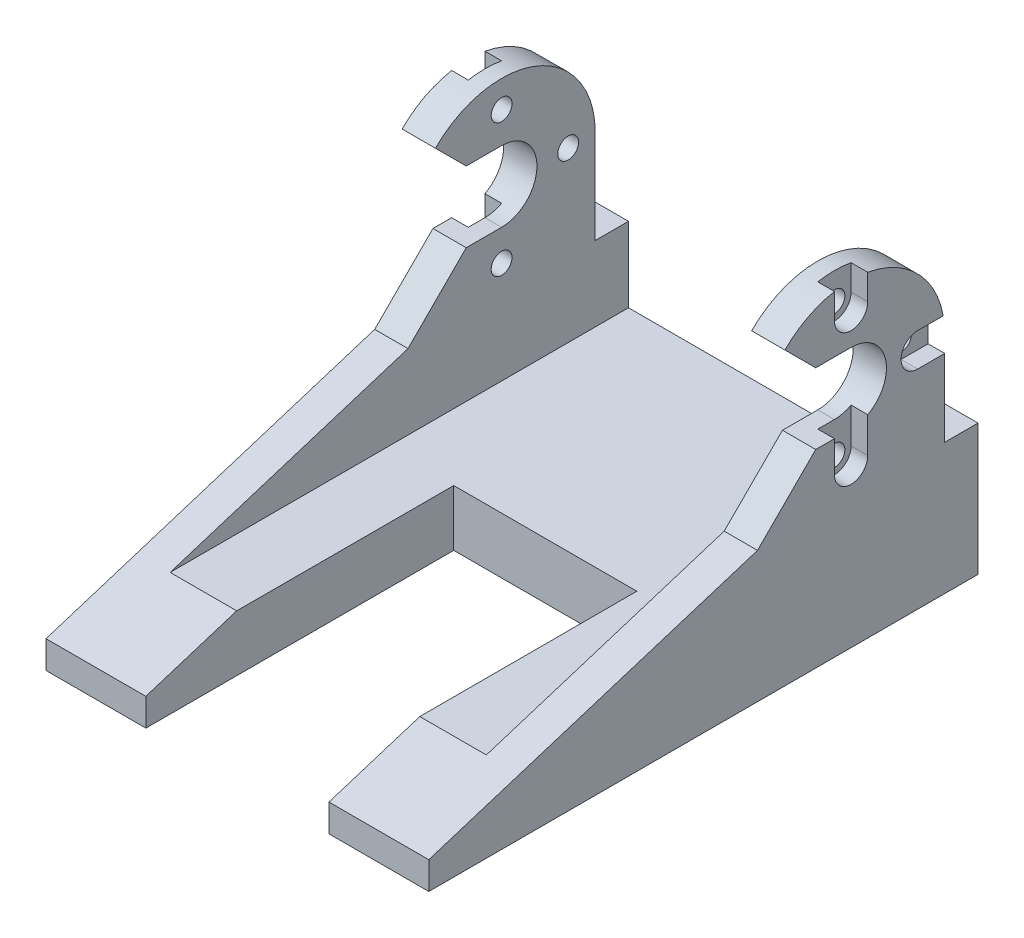
from build123d import *

# Parameters (mm, degrees)
SKETCH1_W                = 50
SKETCH1_H                = 170
BOSS_EXTRUDE1_DEPTH      = 55
SKETCH2_W                = 34
SKETCH2_H                = 27
CUT_EXTRUDE1_DEPTH       = 181.416185527
SKETCH3_W                = 10
SKETCH3_H                = 24
SKETCH3_R                = 4.25
SKETCH3_R_2              = 1
CUT_EXTRUDE2_DEPTH       = 186.539753153
SKETCH4_W                = 2
SKETCH4_H                = 24
CUT_EXTRUDE3_DEPTH       = 178.623196683
SKETCH5_W                = 6.25
SKETCH5_H                = 11.25
CUT_EXTRUDE4_DEPTH       = 186.539753153
SKETCH6_W                = 38
SKETCH6_H                = 10
CUT_EXTRUDE5_DEPTH       = 181.416185527
SKETCH8_W                = 13.25
SKETCH8_H                = 2.25
CUT_EXTRUDE7_DEPTH       = 186.539753153
SKETCH9_W                = 34
SKETCH9_H                = 35.25
CUT_EXTRUDE8_DEPTH       = 179.297679458
SKETCH11_W               = 13.25
SKETCH11_H               = 20.25
CUT_EXTRUDE9_DEPTH       = 184.480414486
SKETCH12_W               = 28.5
SKETCH12_H               = 15
BOSS_EXTRUDE2_DEPTH      = 8
SKETCH14_W               = 34
SKETCH14_H               = 15
SKETCH14_H_2             = 10.25
BOSS_EXTRUDE3_DEPTH      = 13.25
SKETCH16_R               = 4.5
SKETCH16_R_2             = 2.5
CUT_EXTRUDE13_DEPTH      = 8
SKETCH17_R               = 4.5
SKETCH17_W               = 55
SKETCH17_H               = 10.25
CUT_EXTRUDE15_DEPTH      = 175.384811552
SKETCH18_W               = 71.25
SKETCH18_H               = 27.5
SKETCH18_W_2             = 13.75
SKETCH18_W_3             = 16.25
BOSS_EXTRUDE4_DEPTH      = 50
SKETCH19_W               = 38
SKETCH19_H               = 7
CUT_EXTRUDE16_DEPTH      = 152.25227271
SKETCH20_W               = 57.5
SKETCH20_H               = 27.5
CUT_EXTRUDE17_DEPTH      = 102.137591923
CUT_EXTRUDE18_DEPTH      = 100.39221549
SKETCH22_W               = 82.5
SKETCH22_H               = 2.5
BOSS_EXTRUDE5_DEPTH      = 50
SKETCH24_W               = 22
SKETCH24_H               = 17
CUT_EXTRUDE19_DEPTH      = 101.710289941
SKETCH25_W               = 38
SKETCH25_H               = 38.136363636
CUT_EXTRUDE20_DEPTH      = 10
SKETCH27_W               = 38
SKETCH27_H               = 60.136363636
BOSS_EXTRUDE6_DEPTH      = 8.6
SKETCH29_W               = 38
SKETCH29_H               = 1.4
CUT_EXTRUDE21_DEPTH      = 85.601313414
BOSS_EXTRUDE7_DEPTH      = 50
SKETCH31_W               = 38
SKETCH31_H               = 17
CUT_EXTRUDE22_DEPTH      = 117.365802537
SKETCH32_W               = 100
SKETCH32_H               = 3
CUT_EXTRUDE23_DEPTH      = 101.710289941
SKETCH33_W               = 20
SKETCH33_H               = 10
SKETCH33_W_2             = 22
SKETCH33_H_2             = 45
CUT_EXTRUDE24_DEPTH      = 84.137311118
SKETCH34_W               = 8
SKETCH34_H               = 12
CUT_EXTRUDE25_DEPTH      = 76.0787087
BOSS_EXTRUDE8_DEPTH      = 8
SKETCH37_W               = 78
SKETCH37_H               = 9
SKETCH37_W_2             = 12
CUT_EXTRUDE27_DEPTH      = 93.48006542
FILLET1_R                = 10
CUT_EXTRUDE29_DEPTH      = 77.423572934
CUT_EXTRUDE29_DEPTH_BACK = 77.423572934
SKETCH38_W               = 2
SKETCH38_H               = 78
SKETCH38_W_2             = 46
SKETCH38_H_2             = 8
SKETCH39_W               = 22.223383748
SKETCH39_H               = 19.441332461
CUT_EXTRUDE30_DEPTH      = 86.624543794
BOSS_EXTRUDE9_DEPTH      = 0.75
CUT_EXTRUDE31_DEPTH      = 76.967920861
SKETCH44_R               = 1.25
CUT_EXTRUDE32_DEPTH      = 76.967920861
SKETCH45_R               = 1.25
CUT_EXTRUDE33_DEPTH      = 2
CUT_EXTRUDE34_DEPTH      = 76.967920861
SKETCH48_W               = 66
SKETCH48_H               = 3
CUT_EXTRUDE35_DEPTH      = 76.967920861


with BuildPart() as part:
    # Sketch1 → Boss-Extrude1 (new body)
    with BuildSketch(Plane.XY):
        with Locations((0, -85)):
            Rectangle(SKETCH1_W, SKETCH1_H)
    extrude(amount=-BOSS_EXTRUDE1_DEPTH)

    # Sketch2 → Cut-Extrude1 (cut, through all)
    with BuildSketch(Plane.XY):
        with Locations((0, -13.5)):
            Rectangle(SKETCH2_W, SKETCH2_H)
    extrude(amount=-CUT_EXTRUDE1_DEPTH, mode=Mode.SUBTRACT)

    # Sketch3 → Cut-Extrude2 (cut, through all)
    with BuildSketch(Plane(origin=(25, 0, 0), x_dir=(0, 0, -1), z_dir=(1, 0, 0))):
        with Locations((50, -12)):
            Rectangle(SKETCH3_W, SKETCH3_H)
        with Locations((5, -12)):
            Rectangle(SKETCH3_W, SKETCH3_H)
        with Locations(Location((27.5, -12.75, 0), (0, 0, 90))):
            Circle(SKETCH3_R)
        with Locations(Location((35.5, -12.75, 0), (0, 0, 90))):
            Circle(SKETCH3_R_2)
        with Locations(Location((27.5, -4.75, 0), (0, 0, 90))):
            Circle(SKETCH3_R_2)
        with Locations(Location((27.5, -20.75, 0), (0, 0, 90))):
            Circle(SKETCH3_R_2)
        with Locations(Location((19.5, -12.75, 0), (0, 0, 90))):
            Circle(SKETCH3_R_2)
    extrude(amount=-CUT_EXTRUDE2_DEPTH, mode=Mode.SUBTRACT)

    # Sketch4 → Cut-Extrude3 (cut, through all)
    with BuildSketch(Plane.XY.offset(-10)):
        with Locations((-18, -12)):
            Rectangle(SKETCH4_W, SKETCH4_H)
        with Locations((18, -12)):
            Rectangle(SKETCH4_W, SKETCH4_H)
    extrude(amount=-CUT_EXTRUDE3_DEPTH, mode=Mode.SUBTRACT)

    # Sketch5 → Cut-Extrude4 (cut, through all)
    with BuildSketch(Plane(origin=(25, 0, 0), x_dir=(0, 0, -1), z_dir=(1, 0, 0))):
        with BuildLine():
            Line((45, 0), (10, 0))
            Line((10, 0), (10, -12.75))
            Line((10, -12.75), (16.25, -12.75))
            ThreePointArc((16.25, -12.75), (27.5, -1.5), (38.75, -12.75))
            Line((38.75, -12.75), (45, -12.75))
            Line((45, -12.75), (45, 0))
        make_face()
        with Locations((13.125, -18.375)):
            Rectangle(SKETCH5_W, SKETCH5_H)
        with Locations((41.875, -18.375)):
            Rectangle(SKETCH5_W, SKETCH5_H)
    extrude(amount=-CUT_EXTRUDE4_DEPTH, mode=Mode.SUBTRACT)

    # Sketch6 → Cut-Extrude5 (cut, through all)
    with BuildSketch(Plane.XY):
        with Locations((0, -29)):
            Rectangle(SKETCH6_W, SKETCH6_H)
    extrude(amount=-CUT_EXTRUDE5_DEPTH, mode=Mode.SUBTRACT)

    # Sketch8 → Cut-Extrude7 (cut, through all)
    with BuildSketch(Plane(origin=(25, 0, 0), x_dir=(0, 0, -1), z_dir=(1, 0, 0))):
        with BuildLine():
            Line((27.5, -157.5), (27.5, -132.5))
            Line((27.5, -132.5), (13.25, -132.5))
            Line((13.25, -132.5), (13.25, -167.75))
            Line((13.25, -167.75), (17.25, -167.75))
            ThreePointArc((17.25, -167.75), (20.252155493, -160.502155493), (27.5, -157.5))
        make_face()
        with BuildLine():
            Line((41.75, -167.75), (41.75, -132.5))
            Line((41.75, -132.5), (27.5, -132.5))
            Line((27.5, -132.5), (27.5, -157.5))
            ThreePointArc((27.5, -157.5), (34.747844507, -160.502155493), (37.75, -167.75))
            Line((37.75, -167.75), (41.75, -167.75))
        make_face()
        with Locations((48.375, -168.875)):
            Rectangle(SKETCH8_W, SKETCH8_H)
        with Locations((6.625, -168.875)):
            Rectangle(SKETCH8_W, SKETCH8_H)
        with BuildLine():
            Line((17.25, -167.75), (13.25, -167.75))
            Line((13.25, -167.75), (13.25, -170))
            Line((13.25, -170), (17.5, -170))
            ThreePointArc((17.5, -170), (17.31269172, -168.881923142), (17.25, -167.75))
        make_face()
        with BuildLine():
            Line((41.75, -170), (41.75, -167.75))
            Line((41.75, -167.75), (37.75, -167.75))
            ThreePointArc((37.75, -167.75), (37.68730828, -168.881923142), (37.5, -170))
            Line((37.5, -170), (41.75, -170))
        make_face()
        with BuildLine():
            Line((27.5, -167.75), (27.5, -157.5))
            ThreePointArc((27.5, -157.5), (20.252155493, -160.502155493), (17.25, -167.75))
            Line((17.25, -167.75), (27.5, -167.75))
        make_face()
        with BuildLine():
            ThreePointArc((37.75, -167.75), (34.747844507, -160.502155493), (27.5, -157.5))
            Line((27.5, -157.5), (27.5, -167.75))
            Line((27.5, -167.75), (37.75, -167.75))
        make_face()
        with BuildLine():
            Line((27.5, -170), (27.5, -167.75))
            Line((27.5, -167.75), (17.25, -167.75))
            ThreePointArc((17.25, -167.75), (17.31269172, -168.881923142), (17.5, -170))
            Line((17.5, -170), (27.5, -170))
        make_face()
        with BuildLine():
            ThreePointArc((37.5, -170), (37.68730828, -168.881923142), (37.75, -167.75))
            Line((37.75, -167.75), (27.5, -167.75))
            Line((27.5, -167.75), (27.5, -170))
            Line((27.5, -170), (37.5, -170))
        make_face()
    extrude(amount=-CUT_EXTRUDE7_DEPTH, mode=Mode.SUBTRACT)

    # Sketch9 → Cut-Extrude8 (cut, through all)
    with BuildSketch(Plane.XY):
        with Locations((0, -150.125)):
            Rectangle(SKETCH9_W, SKETCH9_H)
    extrude(amount=-CUT_EXTRUDE8_DEPTH, mode=Mode.SUBTRACT)

    # Sketch11 → Cut-Extrude9 (cut, through all)
    with BuildSketch(Plane(origin=(25, 0, 0), x_dir=(0, 0, -1), z_dir=(1, 0, 0))):
        with BuildLine():
            ThreePointArc((17.25, -167.75), (20.252155493, -160.502155493), (27.5, -157.5))
            Line((27.5, -157.5), (27.5, -147.5))
            Line((27.5, -147.5), (13.25, -147.5))
            Line((13.25, -147.5), (13.25, -167.75))
            Line((13.25, -167.75), (17.25, -167.75))
        make_face()
        with BuildLine():
            Line((27.5, -147.5), (27.5, -157.5))
            ThreePointArc((27.5, -157.5), (34.747844507, -160.502155493), (37.75, -167.75))
            Line((37.75, -167.75), (41.75, -167.75))
            Line((41.75, -167.75), (41.75, -147.5))
            Line((41.75, -147.5), (27.5, -147.5))
        make_face()
        with Locations((48.375, -157.625)):
            Rectangle(SKETCH11_W, SKETCH11_H)
        with Locations((6.625, -157.625)):
            Rectangle(SKETCH11_W, SKETCH11_H)
    extrude(amount=-CUT_EXTRUDE9_DEPTH, mode=Mode.SUBTRACT)

    # Sketch12 → Boss-Extrude2 (add)
    with BuildSketch(Plane(origin=(25, 0, 0), x_dir=(0, 0, -1), z_dir=(1, 0, 0))):
        with Locations((27.5, -140)):
            Rectangle(SKETCH12_W, SKETCH12_H)
    boss_extrude2 = extrude(amount=-BOSS_EXTRUDE2_DEPTH)

    # Mirror1: Boss-Extrude2 across plane
    add(boss_extrude2.mirror(Plane(origin=(0, 0, 0), x_dir=(0, 0, 1), z_dir=(1, 0, 0))))

    # Sketch14 → Boss-Extrude3 (add)
    with BuildSketch(Plane.XY):
        with Locations((0, -140)):
            Rectangle(SKETCH14_W, SKETCH14_H)
        with Locations((0, -152.625)):
            Rectangle(SKETCH14_W, SKETCH14_H_2)
    boss_extrude3 = extrude(amount=-BOSS_EXTRUDE3_DEPTH)

    # Mirror2: Boss-Extrude3 across plane
    add(boss_extrude3.mirror(Plane.XY.offset(-27.5)))

    # Sketch16 → Cut-Extrude13 (cut)
    # profile 1 of 3: a face of its own
    with BuildSketch(Plane(origin=(25, 0, 0), x_dir=(0, 0, -1), z_dir=(1, 0, 0))):
        with Locations(Location((16.5, -135.75, 0), (0, 0, 90))):
            Circle(SKETCH16_R)
        with Locations((16.5, -135.75)):
            Circle(SKETCH16_R_2, mode=Mode.SUBTRACT)
    # profile 2 of 3: a face of its own
    with BuildSketch(Plane(origin=(25, 0, 0), x_dir=(0, 0, -1), z_dir=(1, 0, 0))):
        with Locations((16.5, -135.75)):
            Circle(SKETCH16_R_2)
    # profile 3 of 3: a face of its own
    with BuildSketch(Plane(origin=(25, 0, 0), x_dir=(0, 0, -1), z_dir=(1, 0, 0))):
        with Locations(Location((38.5, -135.75, 0), (0, 0, 90))):
            Circle(SKETCH16_R)
    cut_extrude13 = extrude(amount=-CUT_EXTRUDE13_DEPTH, mode=Mode.SUBTRACT)

    # Mirror3: Cut-Extrude13 across plane
    add(cut_extrude13.mirror(Plane(origin=(0, 0, 0), x_dir=(0, 0, 1), z_dir=(1, 0, 0))), mode=Mode.SUBTRACT)

    # Sketch17 → Cut-Extrude15 (cut, through all)
    # profile 1 of 4: a face of its own
    with BuildSketch(Plane(origin=(25, 0, 0), x_dir=(0, 0, -1), z_dir=(1, 0, 0))):
        Polygon((55, -51.5), (27.5, -51.5), (0, -51.5), (0, -147.5), (55, -147.5), align=None)
        with Locations((16.5, -135.75)):
            Circle(SKETCH17_R, mode=Mode.SUBTRACT)
        with Locations((38.5, -135.75)):
            Circle(SKETCH17_R, mode=Mode.SUBTRACT)
    # profile 2 of 4: a face of its own
    with BuildSketch(Plane(origin=(25, 0, 0), x_dir=(0, 0, -1), z_dir=(1, 0, 0))):
        with Locations((27.5, -152.625)):
            Rectangle(SKETCH17_W, SKETCH17_H)
    # profile 3 of 4: a face of its own
    with BuildSketch(Plane(origin=(25, 0, 0), x_dir=(0, 0, -1), z_dir=(1, 0, 0))):
        with Locations((38.5, -135.75)):
            Circle(SKETCH17_R)
    # profile 4 of 4: a face of its own
    with BuildSketch(Plane(origin=(25, 0, 0), x_dir=(0, 0, -1), z_dir=(1, 0, 0))):
        with Locations((16.5, -135.75)):
            Circle(SKETCH17_R)
    extrude(amount=-CUT_EXTRUDE15_DEPTH, mode=Mode.SUBTRACT)

    # Sketch18 → Boss-Extrude4 (add)
    with BuildSketch(Plane(origin=(25, 0, 0), x_dir=(0, 0, -1), z_dir=(1, 0, 0))):
        with Locations((-35.625, -37.75)):
            Rectangle(SKETCH18_W, SKETCH18_H)
        with Locations((61.875, -37.75)):
            Rectangle(SKETCH18_W_2, SKETCH18_H)
        Polygon((38.75, -51.5), (38.75, -24), (16.25, -24), (0, -24), (0, -51.5), align=None)
        with Locations((46.875, -37.75)):
            Rectangle(SKETCH18_W_3, SKETCH18_H)
    extrude(amount=-BOSS_EXTRUDE4_DEPTH)

    # Sketch19 → Cut-Extrude16 (cut, through all)
    with BuildSketch(Plane.XY.offset(71.25)):
        with Locations((0, -27.5)):
            Rectangle(SKETCH19_W, SKETCH19_H)
    extrude(amount=-CUT_EXTRUDE16_DEPTH, mode=Mode.SUBTRACT)

    # Sketch20 → Cut-Extrude17 (cut, through all)
    with BuildSketch(Plane(origin=(25, 0, 0), x_dir=(0, 0, -1), z_dir=(1, 0, 0))):
        with Locations((-42.5, -37.75)):
            Rectangle(SKETCH20_W, SKETCH20_H)
    extrude(amount=-CUT_EXTRUDE17_DEPTH, mode=Mode.SUBTRACT)

    # Sketch21 → Cut-Extrude18 (cut, through all)
    with BuildSketch(Plane(origin=(25, 0, 0), x_dir=(0, 0, -1), z_dir=(1, 0, 0))):
        Polygon((16.25, -24), (-13.75, -51.5), (-13.75, -24), align=None)
    extrude(amount=-CUT_EXTRUDE18_DEPTH, mode=Mode.SUBTRACT)

    # Sketch22 → Boss-Extrude5 (add)
    with BuildSketch(Plane(origin=(25, 0, 0), x_dir=(0, 0, -1), z_dir=(1, 0, 0))):
        with Locations((27.5, -52.75)):
            Rectangle(SKETCH22_W, SKETCH22_H)
    extrude(amount=-BOSS_EXTRUDE5_DEPTH)

    # Sketch24 → Cut-Extrude19 (cut, through all)
    with BuildSketch(Plane(origin=(25, 0, 0), x_dir=(0, 0, -1), z_dir=(1, 0, 0))):
        with Locations((57.75, -32.5)):
            Rectangle(SKETCH24_W, SKETCH24_H)
    extrude(amount=-CUT_EXTRUDE19_DEPTH, mode=Mode.SUBTRACT)

    # Sketch25 → Cut-Extrude20 (cut)
    with BuildSketch(Plane(origin=(0, -31, 0), x_dir=(1, 0, 0), z_dir=(0, 1, 0))):
        with Locations((0, 27.681818182)):
            Rectangle(SKETCH25_W, SKETCH25_H)
    extrude(amount=-CUT_EXTRUDE20_DEPTH, mode=Mode.SUBTRACT)

    # Sketch27 → Boss-Extrude6 (add)
    with BuildSketch(Plane(origin=(0, -41, 0), x_dir=(1, 0, 0), z_dir=(0, 1, 0))):
        with Locations((0, 38.681818182)):
            Rectangle(SKETCH27_W, SKETCH27_H)
    extrude(amount=BOSS_EXTRUDE6_DEPTH)

    # Sketch29 → Cut-Extrude21 (cut, through all)
    with BuildSketch(Plane(origin=(0, 0, -8.613636364), x_dir=(-1, 0, 0), z_dir=(0, 0, -1))):
        with Locations((0, -31.7)):
            Rectangle(SKETCH29_W, SKETCH29_H)
    extrude(amount=-CUT_EXTRUDE21_DEPTH, mode=Mode.SUBTRACT)

    # Sketch30 → Boss-Extrude7 (add)
    with BuildSketch(Plane.ZY.offset(25)):
        Polygon((31.25, -38.957214173), (-16.25, -24), (-7.086363636, -32.4), (13.75, -51.5), (13.75, -53.914428346), (31.25, -53.914428346), align=None)
        Polygon((-16.25, -24), (-16.25, -32.4), (-7.086363636, -32.4), align=None)
    extrude(amount=-BOSS_EXTRUDE7_DEPTH)

    # Sketch31 → Cut-Extrude22 (cut, through all)
    with BuildSketch(Plane(origin=(0, 0, -68.75), x_dir=(-1, 0, 0), z_dir=(0, 0, -1))):
        with Locations((0, -32.5)):
            Rectangle(SKETCH31_W, SKETCH31_H)
    extrude(amount=-CUT_EXTRUDE22_DEPTH, mode=Mode.SUBTRACT)

    # Sketch32 → Cut-Extrude23 (cut, through all)
    with BuildSketch(Plane(origin=(25, 0, 0), x_dir=(0, 0, -1), z_dir=(1, 0, 0))):
        with Locations((18.75, -52.5)):
            Rectangle(SKETCH32_W, SKETCH32_H)
    extrude(amount=-CUT_EXTRUDE23_DEPTH, mode=Mode.SUBTRACT)

    # Sketch33 → Cut-Extrude24 (cut, through all)
    with BuildSketch(Plane(origin=(0, -41, 0), x_dir=(1, 0, 0), z_dir=(0, 1, 0))):
        Polygon((-10, 68.75), (-25, 68.75), (-25, 46.75), (-19, 46.75), (-10, 46.75), (-10, 58.75), align=None)
        Polygon((25, 68.75), (10, 68.75), (10, 58.75), (10, 46.75), (19, 46.75), (25, 46.75), align=None)
        with Locations((0, 63.75)):
            Rectangle(SKETCH33_W, SKETCH33_H)
        with Locations((0, -8.75)):
            Rectangle(SKETCH33_W_2, SKETCH33_H_2)
    extrude(amount=-CUT_EXTRUDE24_DEPTH, mode=Mode.SUBTRACT)

    # Sketch34 → Cut-Extrude25 (cut, through all)
    with BuildSketch(Plane(origin=(0, -41, 0), x_dir=(1, 0, 0), z_dir=(0, 1, 0))):
        with Locations((0, 52.75)):
            Rectangle(SKETCH34_W, SKETCH34_H)
    extrude(amount=-CUT_EXTRUDE25_DEPTH, mode=Mode.SUBTRACT)

    # Sketch36 → Boss-Extrude8 (add)
    with BuildSketch(Plane(origin=(0, -41, 0), x_dir=(1, 0, 0), z_dir=(0, 1, 0))):
        Polygon((4, 58.75), (4, 46.75), (-4, 46.75), (-4, 58.75), (-10, 58.75), (-10, 46.75), (-19, 46.75), (-19, -31.25), (-11, -31.25), (-11, 13.75), (11, 13.75), (11, -31.25), (19, -31.25), (19, 46.75), (10, 46.75), (10, 58.75), align=None)
    extrude(amount=BOSS_EXTRUDE8_DEPTH)

    # Sketch37 → Cut-Extrude27 (cut, through all)
    with BuildSketch(Plane(origin=(25, 0, 0), x_dir=(0, 0, -1), z_dir=(1, 0, 0))):
        with Locations((7.75, -46.5)):
            Rectangle(SKETCH37_W, SKETCH37_H)
        Polygon((-31.25, -33), (-31.25, -38.957214173), (-12.331525614, -33), align=None)
        with Locations((52.75, -46.5)):
            Rectangle(SKETCH37_W_2, SKETCH37_H)
    extrude(amount=-CUT_EXTRUDE27_DEPTH, mode=Mode.SUBTRACT)

    # Fillet1
    # the kernel refuses this fillet: 10 mm, written as the material it takes off along each edge
    with BuildSketch(Plane(origin=(20.874685928, -42, -58.75), x_dir=(0, 0, 1), z_dir=(-1, 0, 0)), Plane(origin=(34.874685928, -42, -58.75), x_dir=(0, 0, 1), z_dir=(-1, 0, 0))) as fillet1_piece_1:
        with BuildLine():
            CenterArc((9.949874371, 10), FILLET1_R, 185.739170477, 84.260829523)
            Line((0, 9), (-0.198997487, 8.98))
            ThreePointArc((-0.198997487, 8.98), (-0.2, 4.5), (-0.2, 0))
            Line((-0.2, 0), (0, -0.2))
            Line((0, -0.2), (9.949874371, -0.2))
            Line((9.949874371, -0.2), (9.949874371, 0))
        make_face()
    extrude(amount=55.749371855, mode=Mode.SUBTRACT)

    # Sketch38 → Cut-Extrude29 (cut, two sides: drawn at the far end of the back side and taken through both)
    with BuildSketch(Plane(origin=(0, 0, 0), x_dir=(1, 0, 0), z_dir=(0, 1, 0)).offset(-CUT_EXTRUDE29_DEPTH_BACK)):
        with Locations((-24, 7.75)):
            Rectangle(SKETCH38_W, SKETCH38_H)
        with Locations((24, 7.75)):
            Rectangle(SKETCH38_W, SKETCH38_H)
        with Locations((0, -27.25)):
            Rectangle(SKETCH38_W_2, SKETCH38_H_2)
    extrude(amount=CUT_EXTRUDE29_DEPTH + CUT_EXTRUDE29_DEPTH_BACK, mode=Mode.SUBTRACT)

    # Sketch39 → Cut-Extrude30 (cut, through all)
    with BuildSketch(Plane(origin=(23, 0, 0), x_dir=(0, 0, -1), z_dir=(1, 0, 0))):
        with Locations((53.861691874, -33.720666231)):
            Rectangle(SKETCH39_W, SKETCH39_H)
    extrude(amount=-CUT_EXTRUDE30_DEPTH, mode=Mode.SUBTRACT)

    # Sketch41 → Boss-Extrude9 (add)
    with BuildSketch(Plane.XZ.offset(42)):
        Polygon((-11, 23.25), (-23, 23.25), (-23, -42.75), (23, -42.75), (23, 23.25), (11, 23.25), (11, -13.75), (-11, -13.75), align=None)
    extrude(amount=BOSS_EXTRUDE9_DEPTH)

    # Sketch42 → Cut-Extrude31 (cut, through all)
    with BuildSketch(Plane(origin=(23, 0, 0), x_dir=(0, 0, -1), z_dir=(1, 0, 0))):
        Polygon((16.25, -24), (27.5, -12.75), (19.545048712, -4.795048712), (8.295048712, -16.045048712), align=None)
    extrude(amount=-CUT_EXTRUDE31_DEPTH, mode=Mode.SUBTRACT)

    # Sketch44 → Cut-Extrude32 (cut, through all)
    with BuildSketch(Plane(origin=(23, 0, 0), x_dir=(0, 0, -1), z_dir=(1, 0, 0))):
        with Locations((27.5, -4.75)):
            Circle(SKETCH44_R)
        with Locations((35.5, -12.75)):
            Circle(SKETCH44_R)
        with Locations((27.5, -20.75)):
            Circle(SKETCH44_R)
    extrude(amount=-CUT_EXTRUDE32_DEPTH, mode=Mode.SUBTRACT)

    # Sketch45 → Cut-Extrude33 (cut)
    # profile 1 of 3: a face of its own
    with BuildSketch(Plane(origin=(23, 0, 0), x_dir=(0, 0, -1), z_dir=(1, 0, 0))):
        with BuildLine():
            Line((25.5, -1.679205087), (25.5, -4.75))
            ThreePointArc((25.5, -4.75), (27.5, -6.75), (29.5, -4.75))
            Line((29.5, -4.75), (29.5, -1.679205087))
            ThreePointArc((29.5, -1.679205087), (27.5, -1.5), (25.5, -1.679205087))
        make_face()
        with Locations((27.5, -4.75)):
            Circle(SKETCH45_R, mode=Mode.SUBTRACT)
    # profile 2 of 3: a face of its own
    with BuildSketch(Plane(origin=(23, 0, 0), x_dir=(0, 0, -1), z_dir=(1, 0, 0))):
        with BuildLine():
            ThreePointArc((38.75, -12.75), (38.705109164, -11.745993717), (38.570794913, -10.75))
            Line((38.570794913, -10.75), (35.5, -10.75))
            ThreePointArc((35.5, -10.75), (33.5, -12.75), (35.5, -14.75))
            Line((35.5, -14.75), (38.75, -14.75))
            Line((38.75, -14.75), (38.75, -12.75))
        make_face()
        with Locations((35.5, -12.75)):
            Circle(SKETCH45_R, mode=Mode.SUBTRACT)
    # profile 3 of 3: a face of its own
    with BuildSketch(Plane(origin=(23, 0, 0), x_dir=(0, 0, -1), z_dir=(1, 0, 0))):
        with BuildLine():
            Line((25.5, -16.5), (25.5, -20.75))
            ThreePointArc((25.5, -20.75), (27.5, -22.75), (29.5, -20.75))
            Line((29.5, -20.75), (29.5, -16.5))
            ThreePointArc((29.5, -16.5), (27.5, -17), (25.5, -16.5))
        make_face()
        with Locations((27.5, -20.75)):
            Circle(SKETCH45_R, mode=Mode.SUBTRACT)
    cut_extrude33 = extrude(amount=-CUT_EXTRUDE33_DEPTH, mode=Mode.SUBTRACT)

    # Mirror4: Cut-Extrude33 across plane
    add(cut_extrude33.mirror(Plane(origin=(0, 0, 0), x_dir=(0, 0, 1), z_dir=(1, 0, 0))), mode=Mode.SUBTRACT)

    # Sketch47 → Cut-Extrude34 (cut, through all)
    with BuildSketch(Plane(origin=(23, 0, 0), x_dir=(0, 0, -1), z_dir=(1, 0, 0))):
        with BuildLine():
            ThreePointArc((25.5, -16.5), (26.469223594, -16.873105626), (27.5, -17))
            Line((27.5, -17), (27.5, -8.5))
            ThreePointArc((27.5, -8.5), (25.873595412, -8.823511987), (24.49479618, -9.74479618))
            ThreePointArc((24.49479618, -9.74479618), (23.25, -12.75), (24.49479618, -15.75520382))
            ThreePointArc((24.49479618, -15.75520382), (24.969842563, -16.164791845), (25.5, -16.5))
        make_face()
        with BuildLine():
            Line((27.5, -8.5), (27.5, -17))
            ThreePointArc((27.5, -17), (28.530776406, -16.873105626), (29.5, -16.5))
            ThreePointArc((29.5, -16.5), (31.144344934, -14.936606961), (31.75, -12.75))
            ThreePointArc((31.75, -12.75), (30.50520382, -9.74479618), (27.5, -8.5))
        make_face()
        with BuildLine():
            Line((17.870481142, -17), (23.25, -17))
            Line((23.25, -17), (24.49479618, -15.75520382))
            ThreePointArc((24.49479618, -15.75520382), (23.25, -12.75), (24.49479618, -9.74479618))
            Line((24.49479618, -9.74479618), (23.25, -8.5))
            Line((23.25, -8.5), (17.870481142, -8.5))
            Line((17.870481142, -8.5), (17.870481142, -17))
        make_face()
        with BuildLine():
            ThreePointArc((24.49479618, -9.74479618), (25.873595412, -8.823511987), (27.5, -8.5))
            Line((27.5, -8.5), (23.25, -8.5))
            Line((23.25, -8.5), (24.49479618, -9.74479618))
        make_face()
        with BuildLine():
            Line((23.25, -17), (25.5, -17))
            Line((25.5, -17), (25.5, -16.5))
            ThreePointArc((25.5, -16.5), (24.969842563, -16.164791845), (24.49479618, -15.75520382))
            Line((24.49479618, -15.75520382), (23.25, -17))
        make_face()
        with BuildLine():
            Line((25.5, -17), (27.5, -17))
            ThreePointArc((27.5, -17), (26.469223594, -16.873105626), (25.5, -16.5))
            Line((25.5, -16.5), (25.5, -17))
        make_face()
    extrude(amount=-CUT_EXTRUDE34_DEPTH, mode=Mode.SUBTRACT)

    # Sketch48 → Cut-Extrude35 (cut, through all)
    with BuildSketch(Plane(origin=(23, 0, 0), x_dir=(0, 0, -1), z_dir=(1, 0, 0))):
        with Locations((9.75, -41.25)):
            Rectangle(SKETCH48_W, SKETCH48_H)
    extrude(amount=-CUT_EXTRUDE35_DEPTH, mode=Mode.SUBTRACT)


solid = part.part
